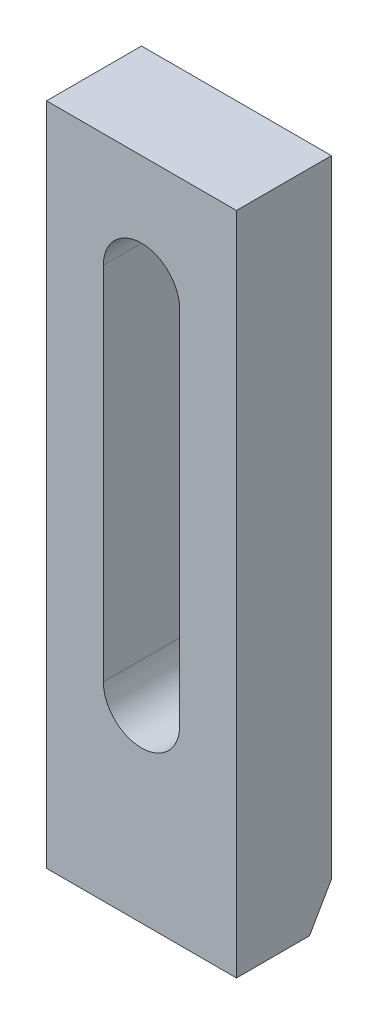
from build123d import *

# Parameters (mm, degrees)
SKETCH_1_W          = 50
SKETCH_1_H          = 175
EXTRUDE_1_DEPTH     = 25
CUT_EXTRUDE_1_DEPTH = 184.711730709
CHAMFER_1_SIZE      = 10
CHAMFER_1_SIZE2     = 5.773502692


with BuildPart() as part:
    # Эскиз1 → Бобышка-Вытянуть1 (new body)
    with BuildSketch(Plane.XY):
        with Locations((25, 87.5)):
            Rectangle(SKETCH_1_W, SKETCH_1_H)
    extrude(amount=EXTRUDE_1_DEPTH)

    # Эскиз2 → Вырез-Вытянуть1 (cut, through all)
    with BuildSketch(Plane.XY.offset(25)):
        with BuildLine():
            Line((14.95, 50), (14.95, 145))
            ThreePointArc((14.95, 145), (25, 155.05), (35.05, 145))
            Line((35.05, 145), (35.05, 50))
            ThreePointArc((35.05, 50), (25, 39.95), (14.95, 50))
        make_face()
    extrude(amount=-CUT_EXTRUDE_1_DEPTH, mode=Mode.SUBTRACT)

    # Фаска1
    chamfer_1_edges = [part.edges().sort_by_distance(p)[0] for p in [
        (25, 0, 0),
    ]]
    chamfer_1_side = [part.faces().sort_by_distance(p)[0] for p in [
        (25, 1.820027472, 0),
    ]]
    chamfer(chamfer_1_edges, length=CHAMFER_1_SIZE, length2=CHAMFER_1_SIZE2, reference=chamfer_1_side[0])


solid = part.part
